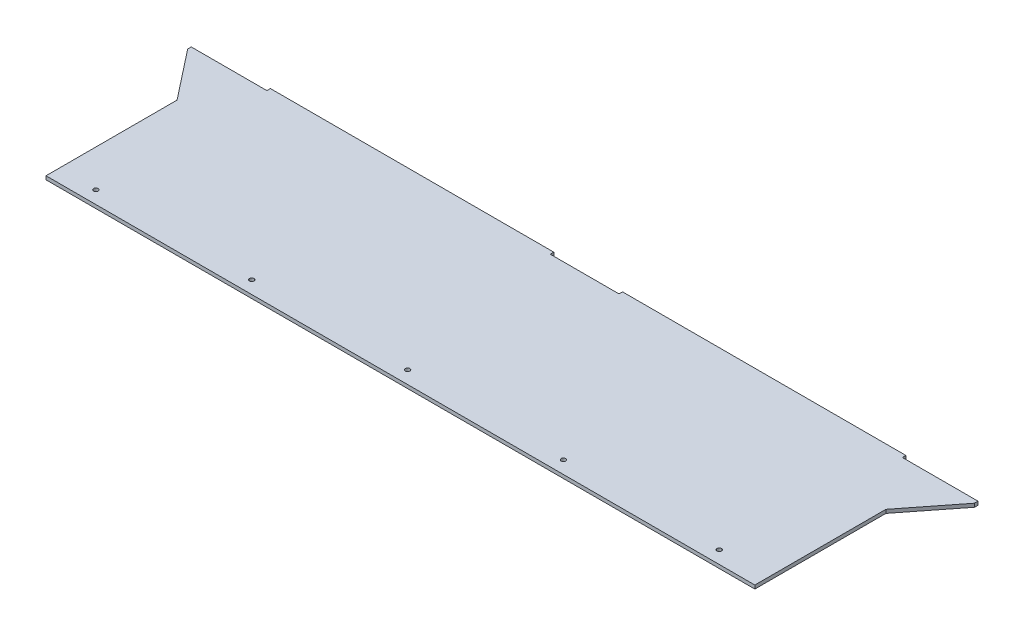
from build123d import *

# Parameters (mm, degrees)
SKETCH1_W           = 635.3556
SKETCH1_H           = 165.1
BOSS_EXTRUDE1_DEPTH = 1.5875
SKETCH2_W           = 254
SKETCH2_H           = 3.175
BOSS_EXTRUDE2_DEPTH = 3.175
BOSS_EXTRUDE3_DEPTH = 3.175
SKETCH4_R           = 2.025
CUT_EXTRUDE1_DEPTH  = 363.887848815
LPATTERN1_COUNT     = 5
LPATTERN1_PITCH     = 139.7


with BuildPart() as part:
    # Sketch1 → Boss-Extrude1 (new, symmetric)
    with BuildSketch(Plane(origin=(0, 0, 0), x_dir=(1, 0, 0), z_dir=(0, 1, 0))):
        Rectangle(SKETCH1_W, SKETCH1_H)
    extrude(amount=BOSS_EXTRUDE1_DEPTH, both=True)

    # Sketch2 → Boss-Extrude2 (add)
    with BuildSketch(Plane(origin=(0, 0, -82.55), x_dir=(-1, 0, 0), z_dir=(0, 0, -1))):
        with Locations((-157.8229, 0)):
            Rectangle(SKETCH2_W, SKETCH2_H)
        with Locations((157.8229, 0)):
            Rectangle(SKETCH2_W, SKETCH2_H)
    extrude(amount=BOSS_EXTRUDE2_DEPTH)

    # Sketch3 → Boss-Extrude3 (add)
    with BuildSketch(Plane.XZ.offset(1.5875)):
        Polygon((317.6778, -82.55), (352.6028, -82.55), (352.6028, -79.375), (317.6778, -34.925), align=None)
    boss_extrude3 = extrude(amount=-BOSS_EXTRUDE3_DEPTH)

    # Mirror1: Boss-Extrude3 across plane
    add(boss_extrude3.mirror(Plane(origin=(0, 0, 0), x_dir=(0, 0, 1), z_dir=(1, 0, 0))))

    # Sketch4 → Cut-Extrude1 (cut, through all)
    with BuildSketch(Plane.XZ.offset(1.5875)):
        with Locations((-284.4038, 71.12)):
            Circle(SKETCH4_R)
    cut_extrude1 = extrude(amount=-CUT_EXTRUDE1_DEPTH, mode=Mode.SUBTRACT)

    # LPattern1: Cut-Extrude1 ×5
    with Locations(*[(i * LPATTERN1_PITCH, 0, 0) for i in range(1, LPATTERN1_COUNT)]):
        add(cut_extrude1, mode=Mode.SUBTRACT)


solid = part.part
